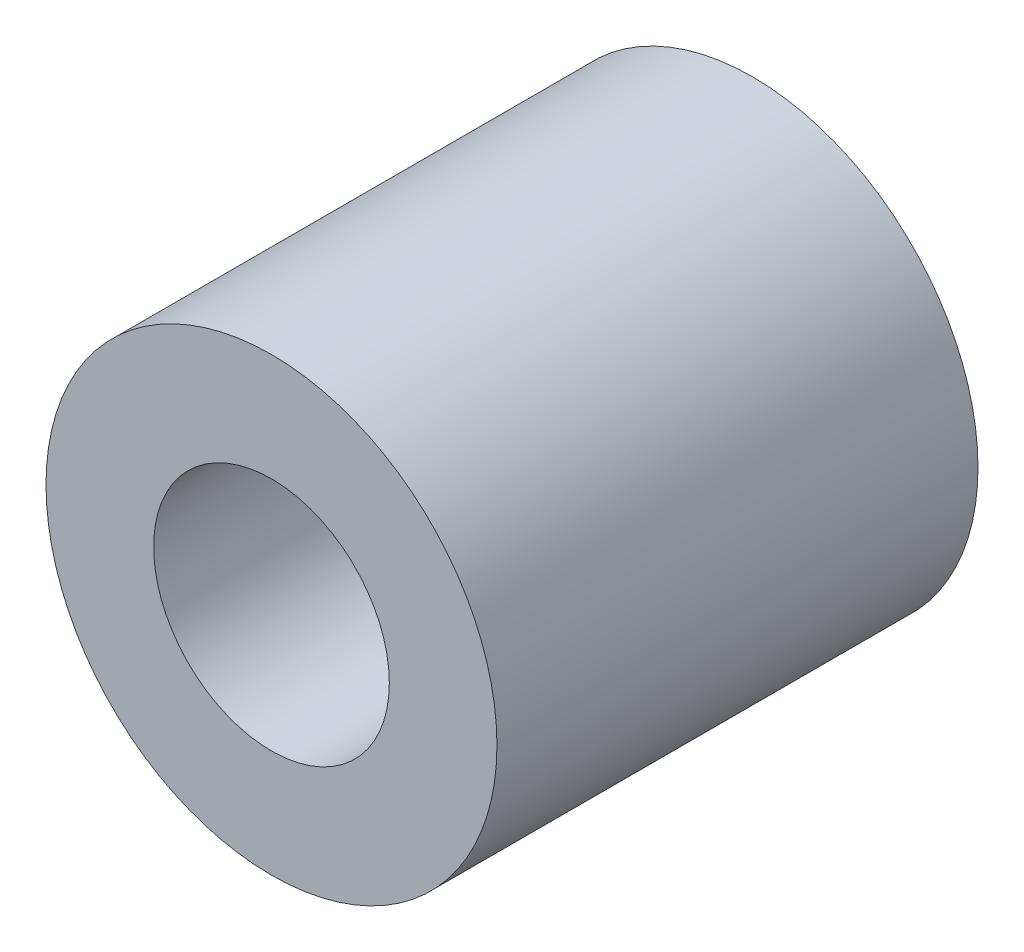
from build123d import *

# Parameters (mm, degrees)
SKETCH1_R           = 4.7625
SKETCH1_R_2         = 2.4892
BOSS_EXTRUDE1_DEPTH = 10.16


with BuildPart() as part:
    # Sketch1 → Boss-Extrude1 (new body)
    with BuildSketch(Plane.XY):
        Circle(SKETCH1_R)
        Circle(SKETCH1_R_2, mode=Mode.SUBTRACT)
    extrude(amount=BOSS_EXTRUDE1_DEPTH)


solid = part.part
